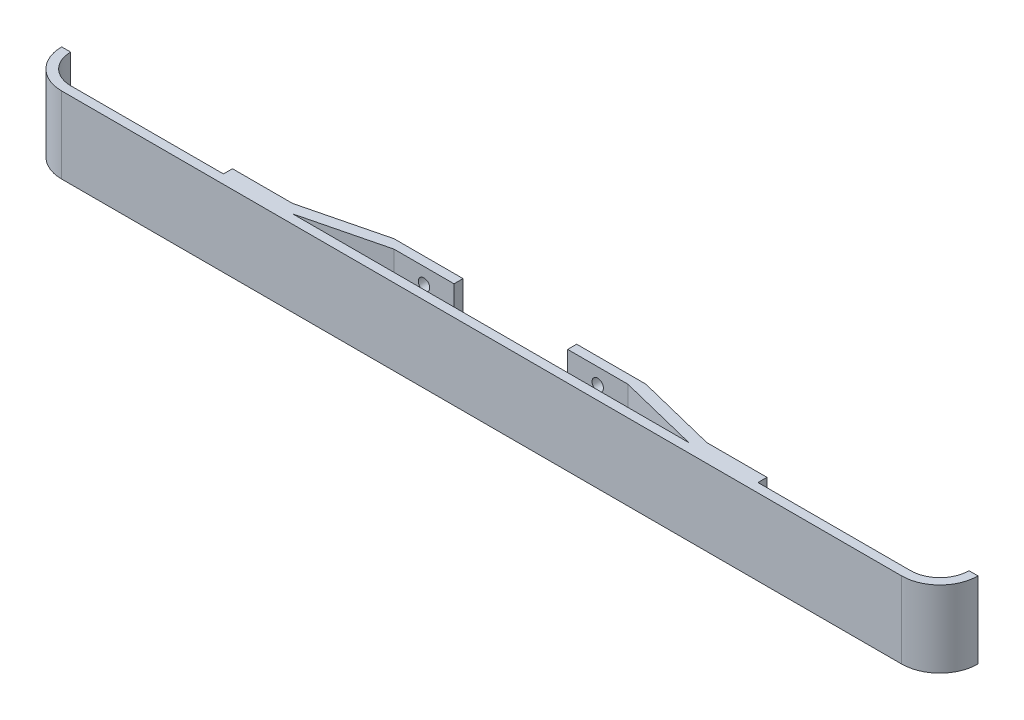
from build123d import *

# Parameters (mm, degrees)
SKETCH1_W                 = 304.8
SKETCH1_H                 = 25.4
BOSS_EXTRUDE2_DEPTH       = 12.7
FILLET1_R                 = 12.7
CUT_EXTRUDE3_DEPTH        = 281.209703849
SKETCH8_W                 = 70
SKETCH8_H                 = 25.4
BOSS_EXTRUDE3_DEPTH       = 9.7
CUT_EXTRUDE4_DEPTH        = 281.209703849
CUT_EXTRUDE5_DEPTH        = 281.209703849
F_6_CLEARANCE_HOLE1_D     = 3.7973
F_6_CLEARANCE_HOLE1_DEPTH = 3


with BuildPart() as part:
    # Sketch1 → Boss-Extrude2 (new body)
    with BuildSketch(Plane.XY):
        with Locations((126.366978193, -2.136448598)):
            Rectangle(SKETCH1_W, SKETCH1_H)
    extrude(amount=BOSS_EXTRUDE2_DEPTH)

    # Fillet1
    fillet1_edges = [part.edges().sort_by_distance(p)[0] for p in [
        (-26.033021807, -2.136448598, 12.7),
        (278.766978193, -2.136448598, 12.7),
    ]]
    fillet(fillet1_edges, radius=FILLET1_R - 0.0001)  # a hair under: the kernel refuses the full size

    # Sketch6 → Cut-Extrude3 (cut, through all)
    with BuildSketch(Plane(origin=(0, 10.563551402, 0), x_dir=(1, 0, 0), z_dir=(0, 1, 0))):
        with BuildLine():
            Line((-23.033021807, 0), (275.766978193, 0))
            ThreePointArc((275.766978193, 0), (272.925913971, -6.858935778), (266.066978193, -9.7))
            Line((266.066978193, -9.7), (-13.333021807, -9.7))
            ThreePointArc((-13.333021807, -9.7), (-20.191957584, -6.858935778), (-23.033021807, 0))
        make_face()
    extrude(amount=-CUT_EXTRUDE3_DEPTH, mode=Mode.SUBTRACT)

    # Sketch8 → Boss-Extrude3 (add)
    with BuildSketch(Plane(origin=(0, 0, 9.7), x_dir=(-1, 0, 0), z_dir=(0, 0, -1))):
        with Locations((-180.266978193, -2.136448598)):
            Rectangle(SKETCH8_W, SKETCH8_H)
        with Locations((-72.466978193, -2.136448598)):
            Rectangle(SKETCH8_W, SKETCH8_H)
    extrude(amount=BOSS_EXTRUDE3_DEPTH)

    # Sketch9 → Cut-Extrude4 (cut, through all)
    with BuildSketch(Plane(origin=(0, 10.563551402, 0), x_dir=(1, 0, 0), z_dir=(0, 1, 0))):
        Polygon((145.266978193, -9.7), (165.266978193, -9.7), (192.266978193, -9.7), (165.266978193, -3), (145.266978193, -3), align=None)
        Polygon((215.266978193, -6.7), (195.266978193, -6.7), (168.266978193, 0), (215.266978193, 0), align=None)
    extrude(amount=-CUT_EXTRUDE4_DEPTH, mode=Mode.SUBTRACT)

    # Sketch12 → Cut-Extrude5 (cut, through all)
    with BuildSketch(Plane(origin=(0, 10.563551402, 0), x_dir=(1, 0, 0), z_dir=(0, 1, 0))):
        Polygon((107.466978193, -9.7), (107.466978193, -3), (87.466978193, -3), (60.466978193, -9.7), align=None)
        Polygon((37.466978193, -6.7), (57.466978193, -6.7), (84.466978193, 0), (37.466978193, 0), align=None)
    extrude(amount=-CUT_EXTRUDE5_DEPTH, mode=Mode.SUBTRACT)

    # #6 Clearance Hole1
    with Locations(Plane.XY.offset(3)):
        with Locations((97.466978193, 5.363551402), (155.266978193, 5.363551402), (155.266978193, -9.636448598), (97.466978193, -9.636448598)):
            Hole(F_6_CLEARANCE_HOLE1_D / 2, depth=F_6_CLEARANCE_HOLE1_DEPTH)


solid = part.part
